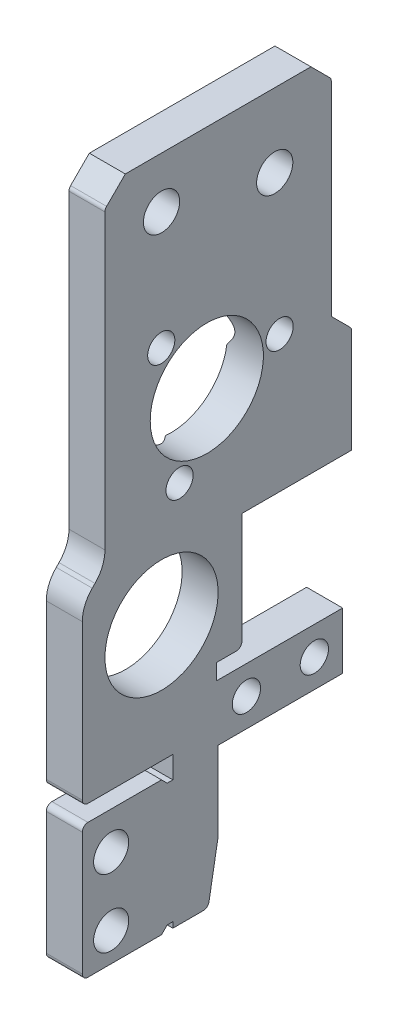
from build123d import *

# Parameters (mm, degrees)
SKETCH1_R                                       = 5
SKETCH1_R_2                                     = 1.6
SKETCH1_R_3                                     = 1.25
SKETCH1_R_4                                     = 1.55
BOSS_EXTRUDE1_DEPTH                             = 3.18
CHAMFER1_SIZE                                   = 5
CHAMFER1_SIZE2                                  = 0.881634904
CSK_FOR_M2_FLAT_HEAD_MACHINE_SCREW1_D           = 2.4
CSK_FOR_M2_FLAT_HEAD_MACHINE_SCREW1_DEPTH       = 3.508967257
CSK_FOR_M2_FLAT_HEAD_MACHINE_SCREW1_CSINK_D     = 4.4
CSK_FOR_M2_FLAT_HEAD_MACHINE_SCREW1_CSINK_ANGLE = 90
CSK_FOR_M2_FLAT_HEAD_MACHINE_SCREW1_TIP         = 0.721032743
SKETCH3_R                                       = 5
CUT_EXTRUDE4_DEPTH                              = 65.449891389
FILLET2_R                                       = 3
CHAMFER2_SIZE                                   = 1.8
FILLET4_R                                       = 0.5


with BuildPart() as part:
    # Sketch1 → Boss-Extrude1 (new body)
    with BuildSketch(Plane(origin=(0, 0, 0), x_dir=(0, 0, -1), z_dir=(1, 0, 0))):
        Polygon((0, 0), (0, 11.85), (7, 11.85), (7.5, 11.35), (8, 11.35), (8, 13.3), (0, 13.3), (0, 28.7), (2, 30.7), (2, 59.81), (22, 59.81), (22, 39.81), (23.8, 39.81), (23.8, 28.68), (14.1, 28.68), (14.1, 18.4), (11.85, 18.4), (11.85, 17), (23, 17), (23, 12), (12, 12), (12, 0), (8, 0), (8, 0.5), (7.5, 0.5), (7, 0), align=None)
        with Locations(Location((7, 23.7, 0), (0, 0, 180))):
            Circle(SKETCH1_R, mode=Mode.SUBTRACT)
        with Locations(Location((7, 55.31, 0), (0, 0, 180))):
            Circle(SKETCH1_R_2, mode=Mode.SUBTRACT)
        with Locations(Location((17, 53.31, 0), (0, 0, 180))):
            Circle(SKETCH1_R_2, mode=Mode.SUBTRACT)
        with Locations(Location((20.5, 14.5, 0), (0, 0, 180))):
            Circle(SKETCH1_R_3, mode=Mode.SUBTRACT)
        with Locations(Location((14.5, 14.5, 0), (0, 0, 180))):
            Circle(SKETCH1_R_3, mode=Mode.SUBTRACT)
        with Locations(Location((2.55, 2.55, 0), (0, 0, 180))):
            Circle(SKETCH1_R_4, mode=Mode.SUBTRACT)
        with Locations(Location((2.55, 8.55, 0), (0, 0, 180))):
            Circle(SKETCH1_R_4, mode=Mode.SUBTRACT)
    extrude(amount=BOSS_EXTRUDE1_DEPTH)

    # Chamfer1
    chamfer1_edges = [part.edges().sort_by_distance(p)[0] for p in [
        (1.59, 0, -12),
    ]]
    chamfer1_side = [part.faces().sort_by_distance(p)[0] for p in [
        (1.59, 6, -12),
    ]]
    chamfer(chamfer1_edges, length=CHAMFER1_SIZE, length2=CHAMFER1_SIZE2, reference=chamfer1_side[0])

    # CSK for M2 Flat Head Machine Screw1
    with Locations(Plane.ZY):
        with Locations((-6.974936087, 44.914674329), (-17.432559713, 40.744769284), (-8.592504199, 33.773154083)):
            CounterSinkHole(CSK_FOR_M2_FLAT_HEAD_MACHINE_SCREW1_D / 2, CSK_FOR_M2_FLAT_HEAD_MACHINE_SCREW1_CSINK_D / 2, depth=CSK_FOR_M2_FLAT_HEAD_MACHINE_SCREW1_DEPTH, counter_sink_angle=CSK_FOR_M2_FLAT_HEAD_MACHINE_SCREW1_CSINK_ANGLE)
            with Locations((0, 0, -(CSK_FOR_M2_FLAT_HEAD_MACHINE_SCREW1_DEPTH + CSK_FOR_M2_FLAT_HEAD_MACHINE_SCREW1_TIP / 2))):  # 118° drill point
                Cone(0, CSK_FOR_M2_FLAT_HEAD_MACHINE_SCREW1_D / 2, CSK_FOR_M2_FLAT_HEAD_MACHINE_SCREW1_TIP, mode=Mode.SUBTRACT)

    # Sketch3 → Cut-Extrude4 (cut, through all)
    with BuildSketch(Plane.ZY):
        with Locations((-11, 39.810865899)):
            Circle(SKETCH3_R)
    extrude(amount=-CUT_EXTRUDE4_DEPTH, mode=Mode.SUBTRACT)

    # Fillet2
    fillet2_edges = [part.edges().sort_by_distance(p)[0] for p in [
        (1.59, 28.7, 0),
        (1.59, 30.7, -2),
    ]]
    fillet(fillet2_edges, radius=FILLET2_R)

    # Chamfer2
    chamfer2_edges = [part.edges().sort_by_distance(p)[0] for p in [
        (1.59, 59.81, -22),
        (1.59, 59.81, -2),
        (1.59, 39.81, -23.8),
    ]]
    chamfer(chamfer2_edges, length=CHAMFER2_SIZE - 0.0001)  # a hair under: the kernel refuses the full size

    # Fillet4
    fillet4_edges = [part.edges().sort_by_distance(p)[0] for p in [
        (1.59, 0, -11.118365096),
        (1.59, 38.0101, -23.8),
        (1.59, 58.0101, -22),
        (1.59, 58.0101, -2),
        (1.59, 0, 0),
        (1.59, 11.85, 0),
        (1.59, 13.3, 0),
        (1.59, 18.4, -14.1),
    ]]
    fillet(fillet4_edges, radius=FILLET4_R)


solid = part.part
